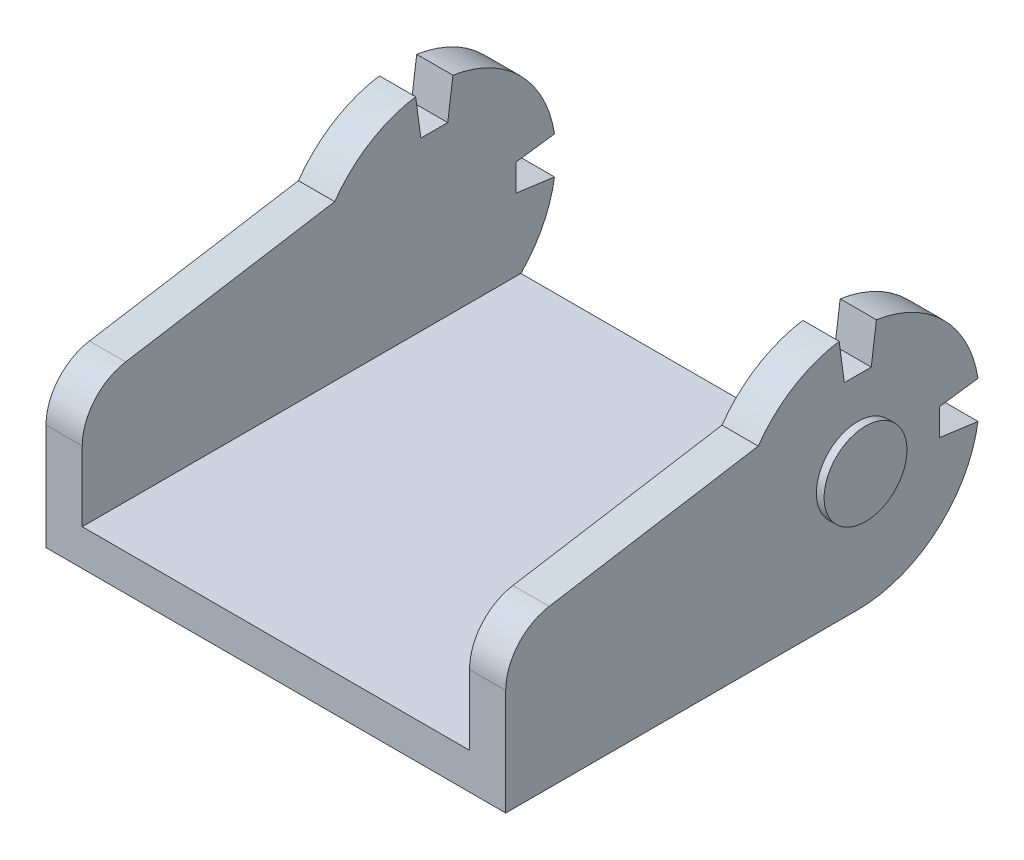
from build123d import *

# Parameters (mm, degrees)
BODY_DEPTH                       = 34
BODY_DEPTH_BACK                  = 15
PIVOT_START                      = 18.7
PIVOT_PIN_R_SKETCH_R             = 4
PIVOT_PIN_R_DEPTH                = 4.25
OUTSIDE_SHAPE_CUT_OUT_DEPTH      = 43.670423012
OUTSIDE_SHAPE_CUT_OUT_DEPTH_BACK = 43.670423012
OUTSIDE_SHAPE_CUT_OUT_SKETCH_W   = 51
OUTSIDE_SHAPE_CUT_OUT_SKETCH_H   = 25.5


with BuildPart() as part:
    # Profile Sketch → Body (new, two sides: drawn at the far end of the back side and taken through both)
    with BuildSketch(Plane.XY.offset(-BODY_DEPTH_BACK)):
        Polygon((-22.2, -11.75), (22.2, -11.75), (22.2, 11.75), (18.7, 11.75), (18.7, -8.25), (-18.7, -8.25), (-18.7, 11.75), (-22.2, 11.75), align=None)
    extrude(amount=BODY_DEPTH + BODY_DEPTH_BACK)

    # Pivot Pin R Sketch → Pivot Pin R (add)
    with BuildSketch(Plane(origin=(0, 0, 0), x_dir=(0, 0, -1), z_dir=(1, 0, 0)).offset(PIVOT_START)):
        Circle(PIVOT_PIN_R_SKETCH_R)
    pivot_pin_r = extrude(amount=PIVOT_PIN_R_DEPTH)

    # Pivot Pin L: Pivot Pin R across plane
    add(pivot_pin_r.mirror(Plane(origin=(0, 0, 0), x_dir=(0, 0, 1), z_dir=(1, 0, 0))))

    # Outside Shape Cut Out Sketch → Outside Shape Cut Out (cut, two sides: drawn at the far end of the back side and taken through both)
    with BuildSketch(Plane(origin=(0, 0, 0), x_dir=(0, 0, -1), z_dir=(1, 0, 0)).offset(-OUTSIDE_SHAPE_CUT_OUT_DEPTH_BACK)):
        with Locations((-10.5, -1)):
            Rectangle(OUTSIDE_SHAPE_CUT_OUT_SKETCH_W, OUTSIDE_SHAPE_CUT_OUT_SKETCH_H)
        with BuildLine():
            Line((-29.809446686, 3.437474429), (-9.617692031, 6.75))
            ThreePointArc((-9.617692031, 6.75), (-6.204756601, 9.978150907), (-1.8, 11.611309142))
            Line((-1.8, 11.611309142), (-1.3, 7.9))
            Line((-1.3, 7.9), (1.3, 7.9))
            Line((1.3, 7.9), (1.8, 11.611309142))
            ThreePointArc((1.8, 11.611309142), (8.308504679, 8.308504679), (11.611309142, 1.8))
            Line((11.611309142, 1.8), (7.9, 1.3))
            Line((7.9, 1.3), (7.9, -1.3))
            Line((7.9, -1.3), (11.611309142, -1.8))
            ThreePointArc((11.611309142, -1.8), (7.645668708, -8.922233465), (0, -11.75))
            Line((0, -11.75), (-34, -11.75))
            Line((-34, -11.75), (-34, -1.496570165))
            ThreePointArc((-34, -1.496570165), (-32.810986318, 1.740153994), (-29.809446686, 3.437474429))
        make_face(mode=Mode.SUBTRACT)
    extrude(amount=OUTSIDE_SHAPE_CUT_OUT_DEPTH + OUTSIDE_SHAPE_CUT_OUT_DEPTH_BACK, mode=Mode.SUBTRACT)


solid = part.part
